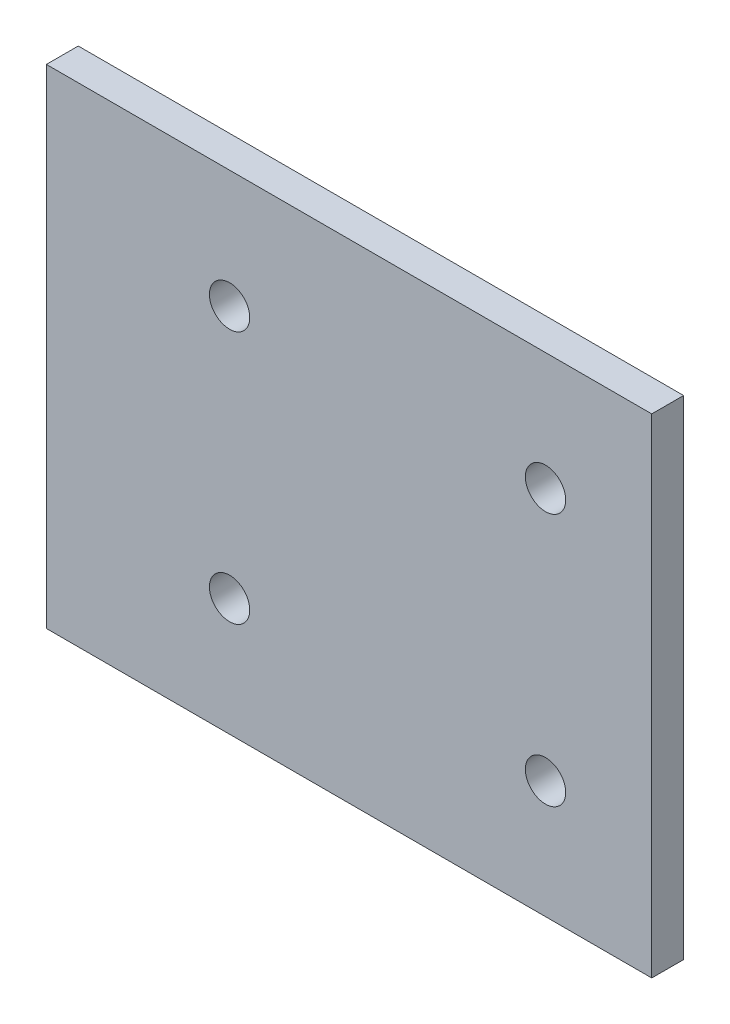
from build123d import *

# Parameters (mm, degrees)
SKETCH1_W             = 57
SKETCH1_H             = 46
BOSS_EXTRUDE1_DEPTH   = 3
F_6_CLEARANCE_HOLE1_D = 3.7973


with BuildPart() as part:
    # Sketch1 → Boss-Extrude1 (new body)
    with BuildSketch(Plane.XY):
        with Locations((-7.514344262, 1.590163934)):
            Rectangle(SKETCH1_W, SKETCH1_H)
    extrude(amount=BOSS_EXTRUDE1_DEPTH)

    # #6 Clearance Hole1 (through all)
    with Locations(Plane.XY.offset(3)):
        with Locations((10.985655738, 13.515163934), (10.985655738, -10.334836066), (-18.764344262, -10.334836066), (-18.764344262, 13.515163934)):
            Hole(F_6_CLEARANCE_HOLE1_D / 2)


solid = part.part
